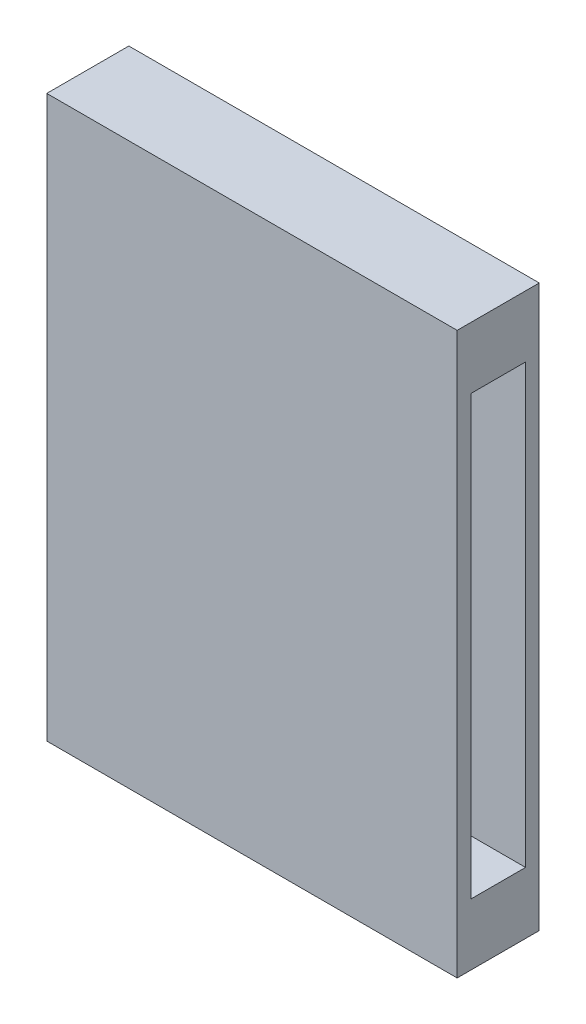
from build123d import *

# Parameters (mm, degrees)
SKETCH1_W           = 30
SKETCH1_H           = 41
BOSS_EXTRUDE1_DEPTH = 6
SKETCH2_W           = 4
SKETCH2_H           = 39
CUT_EXTRUDE1_DEPTH  = 21
SKETCH3_W           = 4
SKETCH3_H           = 32
CUT_EXTRUDE2_DEPTH  = 21


with BuildPart() as part:
    # Sketch1 → Boss-Extrude1 (new body)
    with BuildSketch(Plane.XY):
        with Locations((15, 20.5)):
            Rectangle(SKETCH1_W, SKETCH1_H)
    extrude(amount=BOSS_EXTRUDE1_DEPTH)

    # Sketch2 → Cut-Extrude1 (cut)
    with BuildSketch(Plane.ZY):
        with Locations((3, 20.5)):
            Rectangle(SKETCH2_W, SKETCH2_H)
    extrude(amount=-CUT_EXTRUDE1_DEPTH, mode=Mode.SUBTRACT)

    # Sketch3 → Cut-Extrude2 (cut)
    with BuildSketch(Plane(origin=(30, 0, 0), x_dir=(0, 0, -1), z_dir=(1, 0, 0))):
        with Locations((-3, 20.5)):
            Rectangle(SKETCH3_W, SKETCH3_H)
    extrude(amount=-CUT_EXTRUDE2_DEPTH, mode=Mode.SUBTRACT)


solid = part.part
